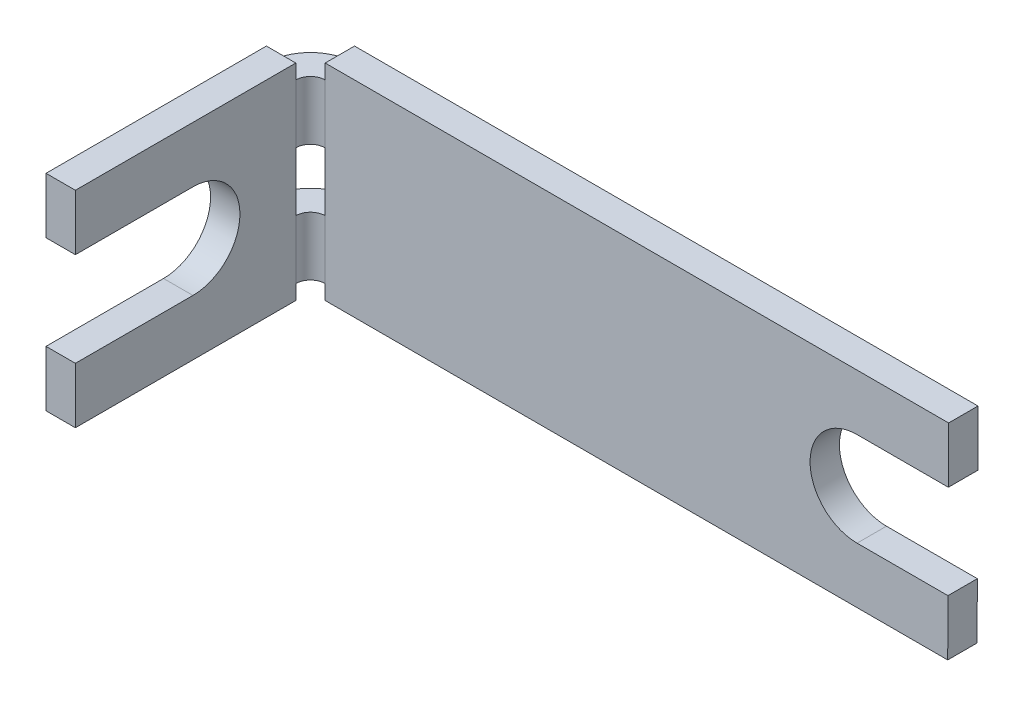
from build123d import *

# Parameters (mm, degrees)
ODGI_CIE_BAZOWE1_DEPTH             = 1
ODGI_CIE_KRAW_DZI1_STRIP_W         = 5
ODGI_CIE_KRAW_DZI1_STRIP_H         = 1
ODGI_CIE_KRAW_DZI1_STRIP_CUT_DEPTH = 7
ODGI_CIE_KRAW_DZI1_DEPTH           = 7
WYTNIJ_WYCI_GNI_CIE1_DEPTH         = 1
WYTNIJ_WYCI_GNI_CIE2_START         = -1.5
SZKIC8_W                           = 4.697403352
SZKIC8_H                           = 2
WYTNIJ_WYCI_GNI_CIE2_DEPTH         = 1.5
WYTNIJ_WYCI_GNI_CIE5_DEPTH         = 0.5
SZKIC7_W                           = 1.5
SZKIC7_H                           = 1.5
WYTNIJ_WYCI_GNI_CIE6_DEPTH         = 0.5


# Sheet-metal steps are written as plain solids
with BuildPart() as part:
    # Szkic1 → Odgięcie bazowe1 (new body)
    with BuildSketch(Plane.XY):
        with BuildLine():
            Line((-5.899587166, 4.522640333), (-5.899587166, -2.477359667))
            Line((-5.899587166, -2.477359667), (15.784981022, -2.477359667))
            Line((15.784981022, -2.477359667), (15.793364792, -0.577359667))
            Line((15.793364792, -0.577359667), (13.620412834, -0.577359667))
            Line((13.620412834, -0.577359667), (12.700412834, -0.577359667))
            ThreePointArc((12.700412834, -0.577359667), (11.100412834, 1.022640333), (12.700412834, 2.622640333))
            Line((12.700412834, 2.622640333), (13.620412834, 2.622640333))
            Line((13.620412834, 2.622640333), (15.807484825, 2.622640333))
            Line((15.807484825, 2.622640333), (15.815868595, 4.522640333))
            Line((15.815868595, 4.522640333), (-5.899587166, 4.522640333))
        make_face()
    extrude(amount=-ODGI_CIE_BAZOWE1_DEPTH)

    # Odgięcie krawędzi1 strip (across the edge) → Odgięcie krawędzi1 strip cut (cut)
    with BuildSketch(Plane(origin=(-5.899587166, 4.522640333, 0), x_dir=(1, 0, 0), z_dir=(0, -1, 0))):
        with Locations((-2, -0.5)):
            Rectangle(ODGI_CIE_KRAW_DZI1_STRIP_W, ODGI_CIE_KRAW_DZI1_STRIP_H)
    extrude(amount=ODGI_CIE_KRAW_DZI1_STRIP_CUT_DEPTH, mode=Mode.SUBTRACT)

    # Odgięcie krawędzi1 section (across the edge) → Odgięcie krawędzi1 (add)
    with BuildSketch(Plane(origin=(-5.899587166, 4.522640333, 0), x_dir=(1, 0, 0), z_dir=(0, -1, 0))):
        with BuildLine():
            Line((-1, 0.5), (-1, 8))
            Line((-1, 8), (0, 8))
            Line((0, 8), (0, 0.5))
            ThreePointArc((0, 0.5), (0.146446609, 0.146446609), (0.5, 0))
            Line((0.5, 0), (0.5, -1))
            ThreePointArc((0.5, -1), (-0.560660172, -0.560660172), (-1, 0.5))
        make_face()
    extrude(amount=ODGI_CIE_KRAW_DZI1_DEPTH)

    # Szkic5 → Wytnij-wyciągnięcie1 (cut)
    with BuildSketch(Plane.ZY.offset(6.899587166)):
        with BuildLine():
            Line((4, -0.577359667), (8, -0.577359667))
            Line((8, -0.577359667), (8, 2.622640333))
            Line((8, 2.622640333), (4, 2.622640333))
            ThreePointArc((4, 2.622640333), (2.4, 1.022640333), (4, -0.577359667))
        make_face()
    extrude(amount=-WYTNIJ_WYCI_GNI_CIE1_DEPTH, mode=Mode.SUBTRACT)

    # Szkic8 → Wytnij-wyciągnięcie2 (cut)
    with BuildSketch(Plane.ZY.offset(6.899587166).offset(WYTNIJ_WYCI_GNI_CIE2_START)):
        with Locations((-1.848701676, 1.022640333)):
            Rectangle(SZKIC8_W, SZKIC8_H)
    extrude(amount=WYTNIJ_WYCI_GNI_CIE2_DEPTH, mode=Mode.SUBTRACT)

    # Szkic6 → Wytnij-wyciągnięcie5 (cut)
    with BuildSketch(Plane.XZ.offset(2.477359667)):
        Polygon((-5.899587166, 0.5), (-5.399587166, 0), (-5.399587166, -1), (-6.899587166, -1), (-6.899587166, 0.5), align=None)
    extrude(amount=-WYTNIJ_WYCI_GNI_CIE5_DEPTH, mode=Mode.SUBTRACT)

    # Szkic7 → Wytnij-wyciągnięcie6 (cut)
    with BuildSketch(Plane(origin=(0, 4.522640333, 0), x_dir=(1, 0, 0), z_dir=(0, 1, 0))):
        with Locations((-6.149587166, 0.25)):
            Rectangle(SZKIC7_W, SZKIC7_H)
    extrude(amount=-WYTNIJ_WYCI_GNI_CIE6_DEPTH, mode=Mode.SUBTRACT)


solid = part.part
